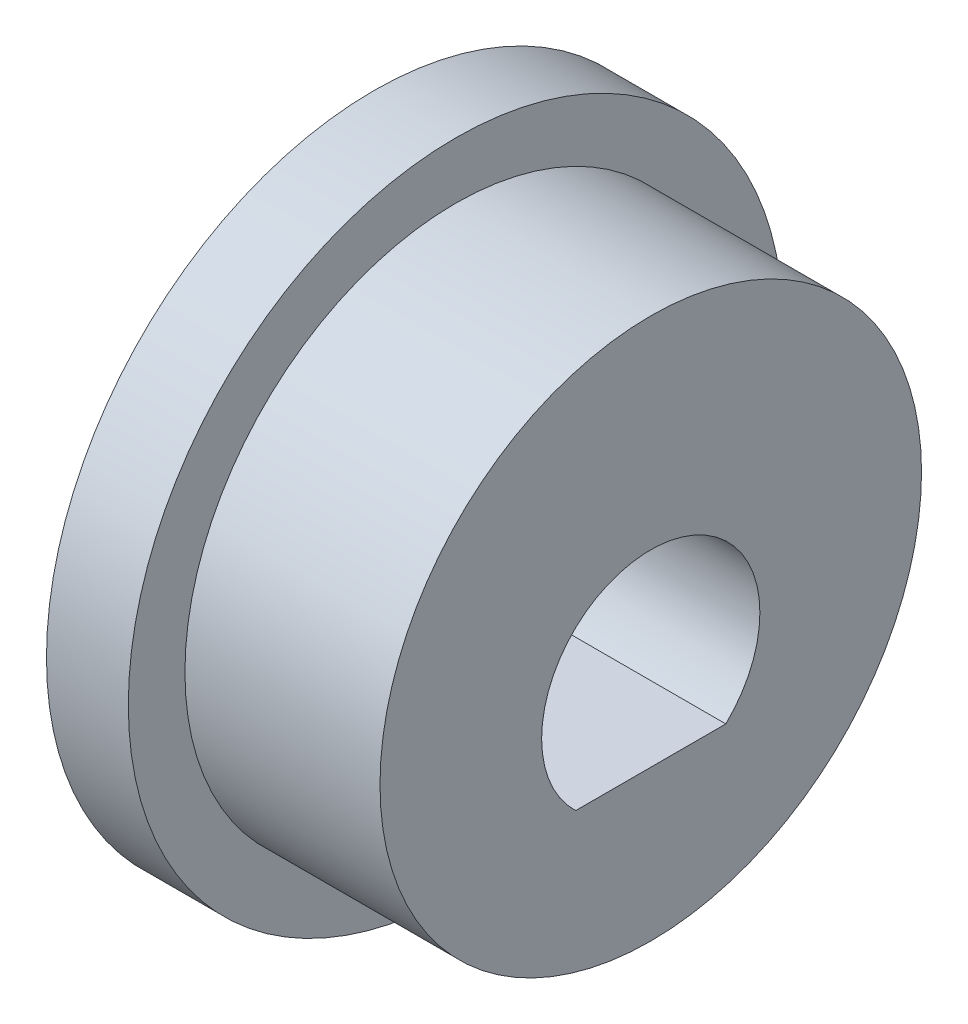
from build123d import *

# Parameters (mm, degrees)
SKIZZE1_R                            = 9.925
AUFSATZ_LINEAR_AUSTRAGEN1_DEPTH      = 7.15
SKIZZE2_R                            = 12
AUFSATZ_LINEAR_AUSTRAGEN2_DEPTH      = 3
SCHNITT_LINEAR_AUSTRAGEN1_DEPTH      = 21.718892345
SCHNITT_LINEAR_AUSTRAGEN1_DEPTH_BACK = 21.718892345


with BuildPart() as part:
    # Skizze1 → Aufsatz-Linear austragen1 (new body)
    with BuildSketch(Plane(origin=(0, 0, 0), x_dir=(0, 0, -1), z_dir=(1, 0, 0))):
        with Locations((0, 1.5)):
            Circle(SKIZZE1_R)
    extrude(amount=AUFSATZ_LINEAR_AUSTRAGEN1_DEPTH)

    # Skizze2 → Aufsatz-Linear austragen2 (add)
    with BuildSketch(Plane.ZY):
        with Locations((0, 1.5)):
            Circle(SKIZZE2_R)
    extrude(amount=AUFSATZ_LINEAR_AUSTRAGEN2_DEPTH)

    # Skizze3 → Schnitt-Linear austragen1 (cut, two sides: drawn at the far end of the back side and taken through both)
    with BuildSketch(Plane(origin=(7.15, 0, 0), x_dir=(0, 0, -1), z_dir=(1, 0, 0)).offset(-SCHNITT_LINEAR_AUSTRAGEN1_DEPTH_BACK)):
        with BuildLine():
            Line((2.75, -2.90473751), (-2.75, -2.90473751))
            ThreePointArc((-2.75, -2.90473751), (0, 4), (2.75, -2.90473751))
        make_face()
    extrude(amount=SCHNITT_LINEAR_AUSTRAGEN1_DEPTH + SCHNITT_LINEAR_AUSTRAGEN1_DEPTH_BACK, mode=Mode.SUBTRACT)


solid = part.part
